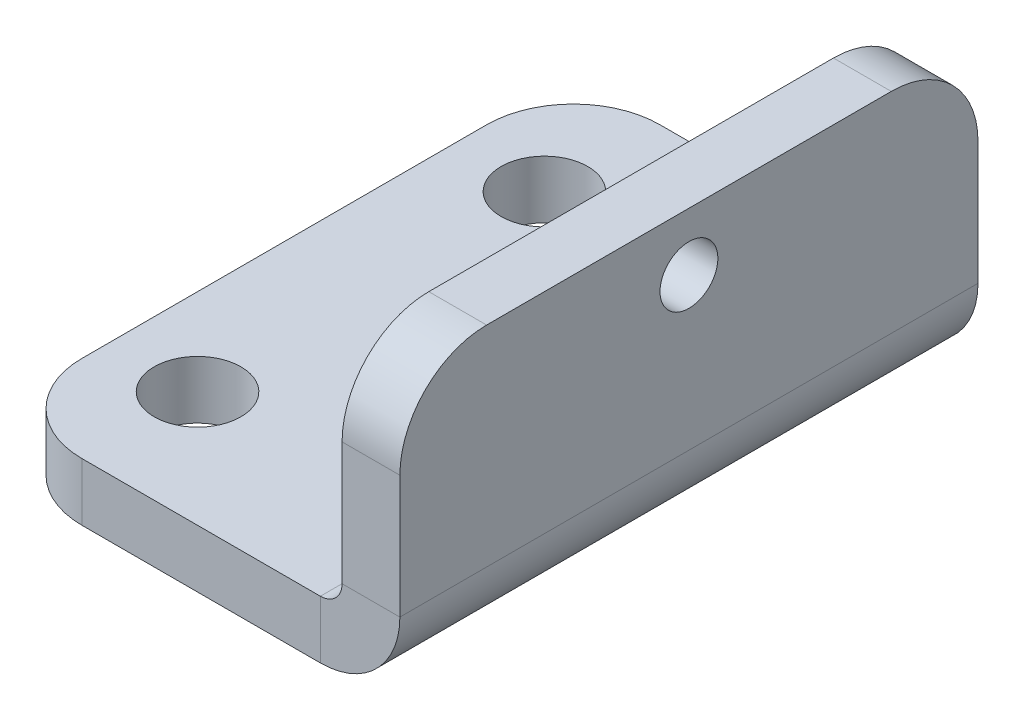
from build123d import *

# Parameters (mm, degrees)
BASE_FLANGE1_DEPTH = 10
FILLET1_R          = 3
SKETCH8_R          = 1.5
CUT_EXTRUDE1_DEPTH = 18.549928775
SKETCH9_R          = 1
CUT_EXTRUDE2_DEPTH = 18.549928775


# Sheet-metal steps are written as plain solids
with BuildPart() as part:
    # Sketch2 → Base-Flange1 (new, symmetric)
    with BuildSketch(Plane.XY):
        with BuildLine():
            Line((-12, 0), (-0.75, 0))
            ThreePointArc((-0.75, 0), (-0.219669914, 0.219669914), (0, 0.75))
            Line((0, 0.75), (0, 8))
            Line((0, 8), (2, 8))
            Line((2, 8), (2, 0.75))
            ThreePointArc((2, 0.75), (1.194543648, -1.194543648), (-0.75, -2))
            Line((-0.75, -2), (-12, -2))
            Line((-12, -2), (-12, 0))
        make_face()
    extrude(amount=BASE_FLANGE1_DEPTH, both=True)

    # Fillet1
    fillet1_edges = [part.edges().sort_by_distance(p)[0] for p in [
        (-12, -1, 10),
        (1, 8, 10),
        (-12, -1, -10),
        (1, 8, -10),
    ]]
    fillet(fillet1_edges, radius=FILLET1_R)

    # Sketch8 → Cut-Extrude1 (cut, through all)
    with BuildSketch(Plane(origin=(0, 0, 0), x_dir=(1, 0, 0), z_dir=(0, 1, 0))):
        with Locations(Location((-9, 6, 0), (0, 0, 270))):
            Circle(SKETCH8_R)
        with Locations(Location((-9, -6, 0), (0, 0, 90))):
            Circle(SKETCH8_R)
    extrude(amount=-CUT_EXTRUDE1_DEPTH, mode=Mode.SUBTRACT)

    # Sketch9 → Cut-Extrude2 (cut, through all)
    with BuildSketch(Plane.ZY):
        with Locations((0, 6)):
            Circle(SKETCH9_R)
    extrude(amount=-CUT_EXTRUDE2_DEPTH, mode=Mode.SUBTRACT)


solid = part.part
